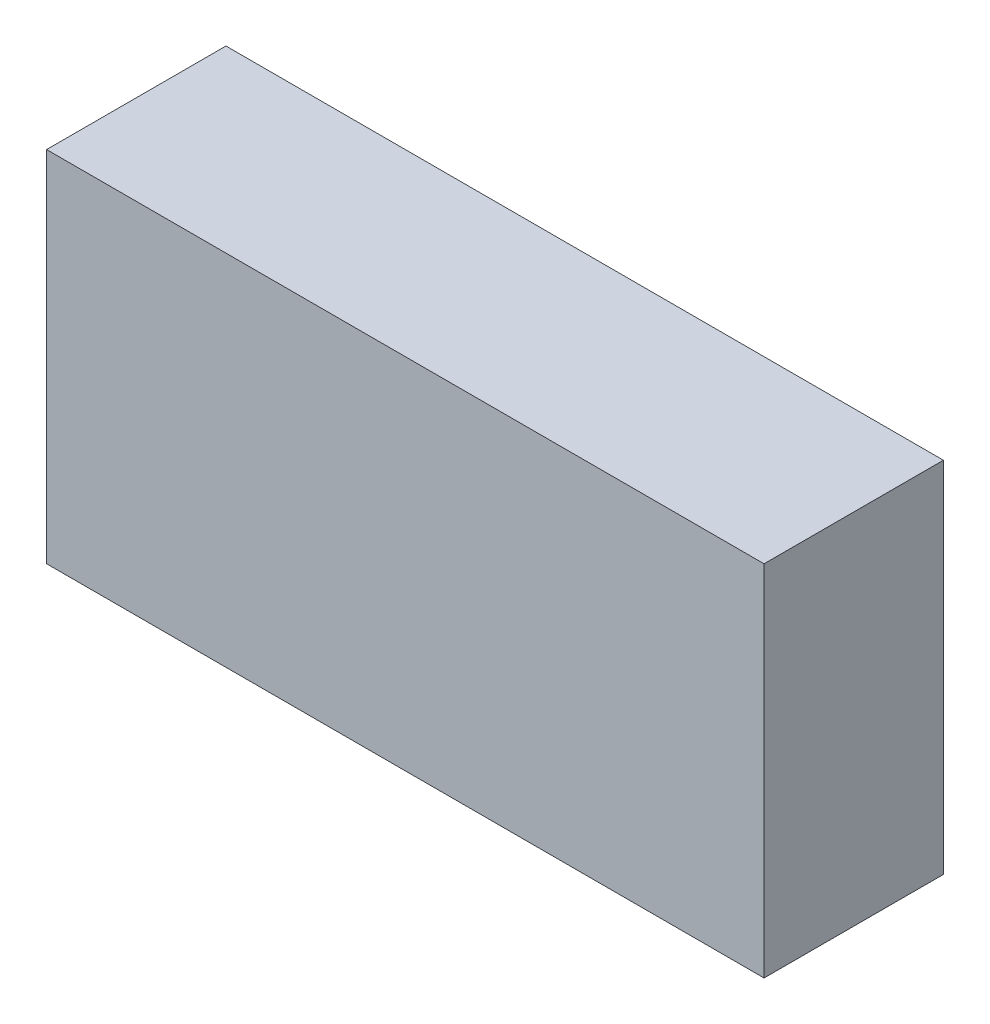
from build123d import *

# Parameters (mm, degrees)
SKETCH1_W           = 40
SKETCH1_H           = 20
BOSS_EXTRUDE1_DEPTH = 10


with BuildPart() as part:
    # Sketch1 → Boss-Extrude1 (new body)
    with BuildSketch(Plane.XY):
        with Locations((20, 10)):
            Rectangle(SKETCH1_W, SKETCH1_H)
    extrude(amount=-BOSS_EXTRUDE1_DEPTH)


solid = part.part
